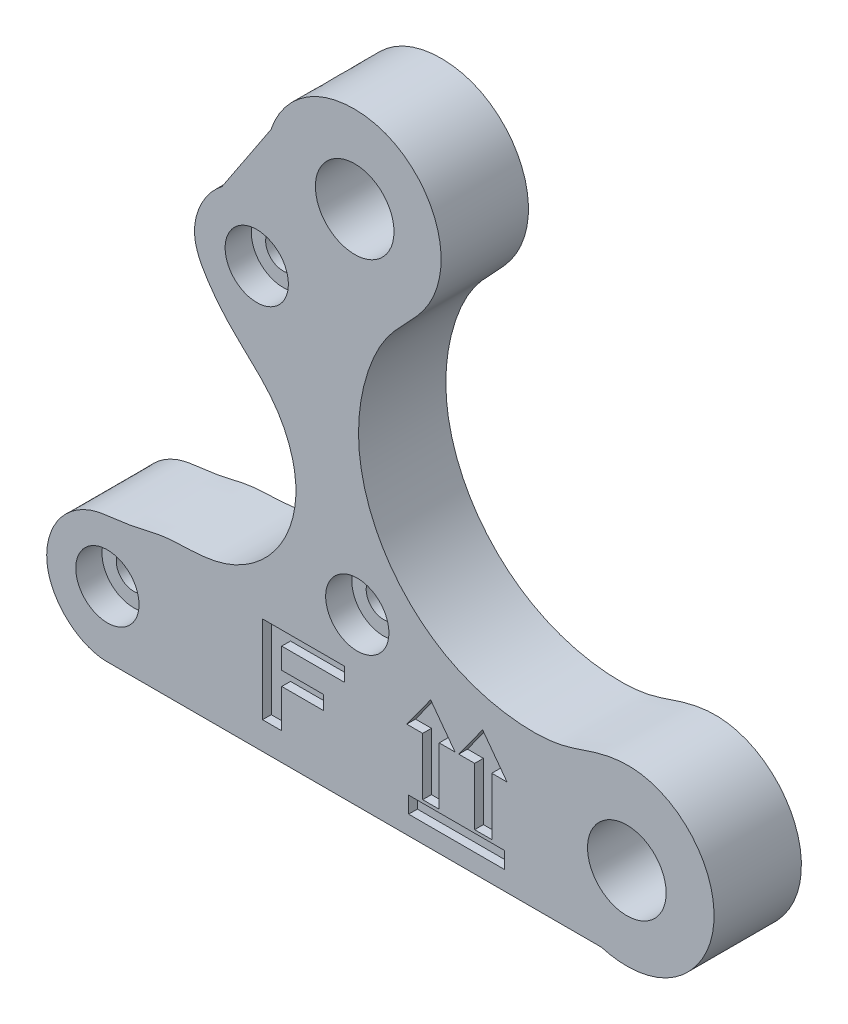
from build123d import *

# Parameters (mm, degrees)
MODEL_R            = 1.982131687
MODEL_R_2          = 4.500000401
MODEL_R_3          = 4.499999885
MODEL_R_4          = 1.982132095
MODEL_R_5          = 1.982132281
MAIN_BODY_DEPTH    = 10
MODEL_5_W          = 10.990000248
MODEL_5_H          = 1.88999939
SYMBOLS_DEPTH      = 1
MODEL_6_R          = 3.622220897
MODEL_6_R_2        = 1.982131687
MODEL_6_R_3        = 3.622221696
MODEL_6_R_4        = 1.982132095
MODEL_6_R_5        = 3.622221607
MODEL_6_R_6        = 1.982132281
RECESS_HOLES_DEPTH = 3


with BuildPart() as part:
    # Model → Main body (new body)
    with BuildSketch(Plane.XY):
        with BuildLine():
            Line((23.822090149, -29.157382965), (-32.360315323, -29.152118683))
            add(Edge.make_bspline(
                [(-19.646411896, 24.540298462), (-21.564792449, 23.105195455), (-23.841742852, 18.953939475), (-21.302898529, 14.255513473), (-18.128795883, 10.311874972), (-12.995839969, 6.377217574), (-10.306787842, -1.286846954), (-12.842057262, -8.919562483), (-18.238411546, -12.793744103), (-22.977029492, -13.358525598), (-26.654221983, -13.354318687), (-30.478734058, -14.545235056), (-35.115583542, -14.651208405), (-39.144235068, -17.949664853), (-40.665066767, -25.06345949), (-35.838270577, -29.356023787), (-32.360315323, -29.152118683)],
                knots=[0, 0, 0, 0, 0.094014292, 0.141298497, 0.188881958, 0.283264098, 0.376439946, 0.469670065, 0.562856228, 0.604372165, 0.645683015, 0.698736813, 0.751990017, 0.814117826, 0.875937352, 1, 1, 1, 1], degree=3))
            Line((-19.646411896, 24.540298462), (-14.039240777, 33.000141144))
            add(Edge.make_bspline(
                [(-14.039240777, 33.000141144), (-13.19071653, 35.566785205), (-9.428545185, 39.890462136), (-1.240482436, 40.227161998), (4.224357672, 35.849130286), (6.101836751, 29.785919399), (4.088604491, 23.704772415), (-0.714589534, 19.84686079), (-3.754337416, 13.318571783), (-4.532032748, 5.090685956), (-1.083382407, -3.595992048), (5.833063403, -9.872091838), (13.322627975, -11.907851942), (19.431961776, -11.622325029), (23.61765145, -9.821025767), (28.238719653, -9.317176269), (33.054575989, -11.252123037), (36.644012908, -15.836049004), (37.082609479, -22.830337162), (32.109614913, -29.337012279), (26.409759084, -29.935204121), (23.822090149, -29.157382965)],
                knots=[0, 0, 0, 0, 0.062813045, 0.124346059, 0.171052899, 0.217760144, 0.264487218, 0.311758756, 0.359005719, 0.429474083, 0.49993064, 0.57038679, 0.640844197, 0.676292234, 0.71174524, 0.747018813, 0.782282843, 0.828981609, 0.875682123, 0.937205181, 1, 1, 1, 1], degree=3))
        make_face()
        with Locations((-32.764152366, -21.656645079)):
            Circle(MODEL_R, mode=Mode.SUBTRACT)
        with Locations((26.717050282, -20.079819691)):
            Circle(MODEL_R_2, mode=Mode.SUBTRACT)
        with Locations((-4.446658398, 29.913034956)):
            Circle(MODEL_R_3, mode=Mode.SUBTRACT)
        with Locations((-15.660932596, 18.664811281)):
            Circle(MODEL_R_4, mode=Mode.SUBTRACT)
        with Locations((-4.148263778, -10.150956103)):
            Circle(MODEL_R_5, mode=Mode.SUBTRACT)
    extrude(amount=-MAIN_BODY_DEPTH)

    # Model<5> → Symbols (cut)
    with BuildSketch(Plane.XY):
        Polygon((-15, -26), (-12.800000191, -26), (-12.800000191, -21.600000381), (-8, -21.600000381), (-8, -20), (-12.800000191, -20), (-12.800000191, -17.600000381), (-5.599999905, -17.600000381), (-5.599999905, -16), (-15, -16), align=None)
        with Locations((7.225000143, -26.055000305)):
            Rectangle(MODEL_5_W, MODEL_5_H)
        Polygon((1.519999981, -18.180000305), (3.339999914, -18.180000305), (3.339999914, -24.760000229), (5.230000019, -24.760000229), (5.230000019, -18.180000305), (7.050000191, -18.180000305), (4.25, -14.399999619), align=None)
        Polygon((7.46999979, -18.180000305), (9.289999962, -18.180000305), (9.289999962, -24.760000229), (11.25, -24.760000229), (11.25, -18.180000305), (13, -18.180000305), (10.199999809, -14.399999619), align=None)
    extrude(amount=-SYMBOLS_DEPTH, mode=Mode.SUBTRACT)

    # Model<6> → Recess holes (cut)
    # profile 1 of 3: a face of its own
    with BuildSketch(Plane.XY):
        with Locations((-32.764152366, -21.656645079)):
            Circle(MODEL_6_R)
        with Locations((-32.764152366, -21.656645079)):
            Circle(MODEL_6_R_2, mode=Mode.SUBTRACT)
    # profile 2 of 3: a face of its own
    with BuildSketch(Plane.XY):
        with Locations((-15.660932596, 18.664811281)):
            Circle(MODEL_6_R_3)
        with Locations((-15.660932596, 18.664811281)):
            Circle(MODEL_6_R_4, mode=Mode.SUBTRACT)
    # profile 3 of 3: a face of its own
    with BuildSketch(Plane.XY):
        with Locations((-4.148263778, -10.150956103)):
            Circle(MODEL_6_R_5)
        with Locations((-4.148263778, -10.150956103)):
            Circle(MODEL_6_R_6, mode=Mode.SUBTRACT)
    extrude(amount=-RECESS_HOLES_DEPTH, mode=Mode.SUBTRACT)


solid = part.part
